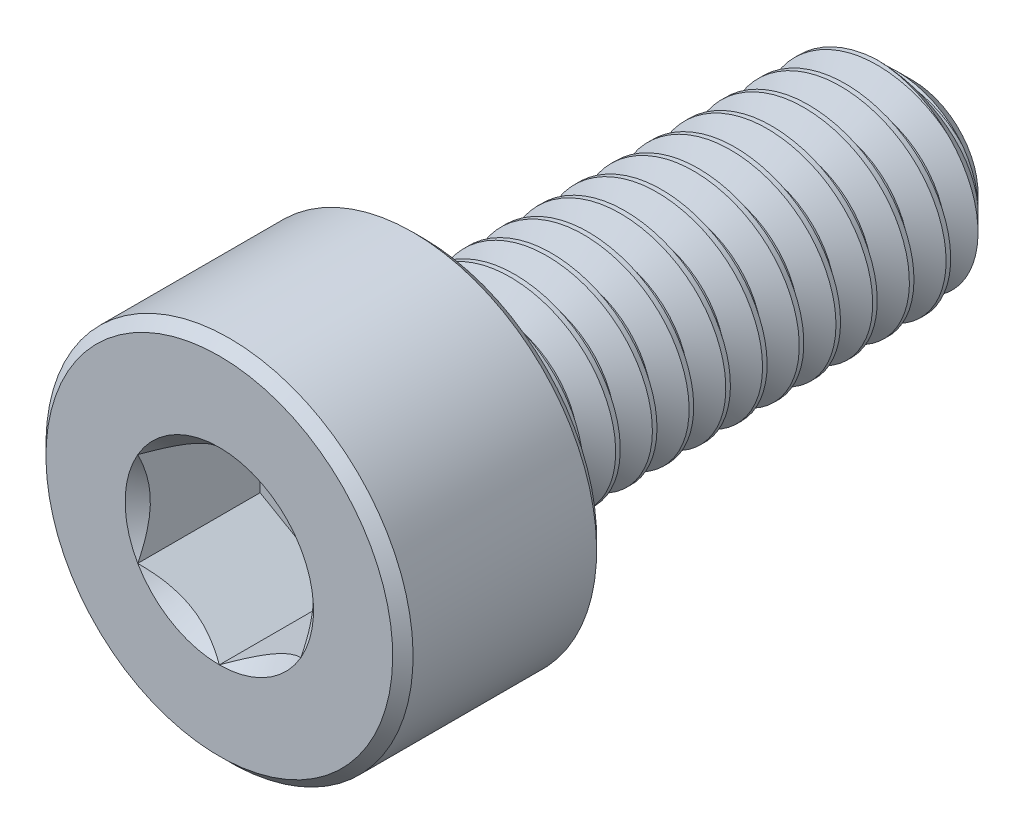
from build123d import *

# Parameters (mm, degrees)
CUT_EXTRUDE1_DEPTH = 1.5
CUT_SWEEP1_PITCH   = 0.45
CUT_SWEEP1_TO      = 6


with BuildPart() as part:
    # Sketch2 → Revolve1 (revolve)
    with BuildSketch(Plane(origin=(0, 0, 0), x_dir=(0, 0, -1), z_dir=(1, 0, 0))):
        Polygon((-4.25, 0), (-4.25, 2.125), (-4.125, 2.25), (-1.875, 2.25), (-1.75, 2.125), (-1.75, 1.25), (3.8, 1.25), (4.25, 0.8), (4.25, 0), align=None)
    revolve(axis=Axis((0, 0, -4.25), (0, 0, 1)))

    # Sketch3 → Cut-Extrude1 (cut)
    with BuildSketch(Plane.XY.offset(4.25)):
        Polygon((1, -0.577350269), (1, 0.577350269), (0, 1.154700538), (-1, 0.577350269), (-1, -0.577350269), (0, -1.154700538), align=None)
    extrude(amount=-CUT_EXTRUDE1_DEPTH, mode=Mode.SUBTRACT)

    # Cut-Extrude2 cone 1 section (through the dimple's axis) → Cut-Extrude2 (revolve, cut)
    with BuildSketch(Plane(origin=(0, 0, 4.25), x_dir=(0, -1, 0), z_dir=(1, 0, 0))):
        Polygon((0, 0), (1.154700538, 0), (0, 1.154700538), align=None)
    revolve(axis=Axis((0, 0, 4.25), (0, 0, -1)), mode=Mode.SUBTRACT)


with BuildPart() as body_2:
    # Split1: read off the stored shape, not the designer's step
    # Split1: the piece on the far side of the plane
    add(part.part)
    split(bisect_by=Plane.XY.offset(1.75), keep=Keep.BOTTOM)

    # Cut-Sweep1: arcs per turn and ends read off the stored shape
    # Cut-Sweep1: the profile of Sketch7 screwed along a right-hand helix through 14.483333 turns, 6 arcs to a turn; built about Z, then put on its axis
    cut_sweep1_z = Axis((0, 0, 0), (0, 0, 1))
    cut_sweep1_corners = [(1.274356964, 0, 0.0140625), (1.274356964, 0, -0.4078125), (0.957716426, 0, -0.225), (0.957716426, 0, -0.16875)]
    with BuildLine(mode=Mode.PRIVATE) as cut_sweep1_profile:
        Line(cut_sweep1_corners[0], cut_sweep1_corners[1])
        Line(cut_sweep1_corners[1], cut_sweep1_corners[2])
        Line(cut_sweep1_corners[2], cut_sweep1_corners[3])
        Line(cut_sweep1_corners[3], cut_sweep1_corners[0])
    cut_sweep1_cap = Face(cut_sweep1_profile.wire())
    cut_sweep1_turn_angles = [0, 30, 60, 90, 120, 150, 180, 210, 240, 270, 300, 330, 360]
    cut_sweep1_turn_weights = [1, 0.8660254037844387, 1, 0.8660254037844387, 1, 0.8660254037844387, 1, 0.8660254037844387, 1, 0.8660254037844387, 1, 0.8660254037844387, 1]
    cut_sweep1_turn_rails = [Edge.make_bspline([Vector(p[0], p[1], 0).rotate(cut_sweep1_z, cut_sweep1_turn_angles[k]) / cut_sweep1_turn_weights[k] + Vector(0, 0, p[2] + CUT_SWEEP1_PITCH * cut_sweep1_turn_angles[k] / 360) for k in range(13)], [0, 0, 0, 1, 1, 2, 2, 3, 3, 4, 4, 5, 5, 6, 6, 6], 2, cut_sweep1_turn_weights) for p in cut_sweep1_corners]
    cut_sweep1_turn_sides = [Face.make_surface_from_curves(cut_sweep1_turn_rails[p[0]], cut_sweep1_turn_rails[p[1]]) for p in [(0, 1), (1, 2), (2, 3), (3, 0)]]
    cut_sweep1_last_angles = [5040, 5070, 5100, 5130, 5160, 5187, 5214]
    cut_sweep1_last_weights = [1, 0.8660254037844387, 1, 0.8660254037844387, 1, 0.8910065241881229, 1]
    cut_sweep1_last_rails = [Edge.make_bspline([Vector(p[0], p[1], 0).rotate(cut_sweep1_z, cut_sweep1_last_angles[k]) / cut_sweep1_last_weights[k] + Vector(0, 0, p[2] + CUT_SWEEP1_PITCH * cut_sweep1_last_angles[k] / 360) for k in range(7)], [0, 0, 0, 1, 1, 2, 2, 3, 3, 3], 2, cut_sweep1_last_weights) for p in cut_sweep1_corners]
    cut_sweep1_last_sides = [Face.make_surface_from_curves(cut_sweep1_last_rails[p[0]], cut_sweep1_last_rails[p[1]]) for p in [(0, 1), (1, 2), (2, 3), (3, 0)]]
    cut_sweep1 = Plane(origin=(0, 0, -4.25), x_dir=(0, 1, 0), z_dir=(0, 0, 1)) * split(Solid(Shell([*[p.moved(Location((0, 0, CUT_SWEEP1_PITCH * i))) for i in range(14) for p in cut_sweep1_turn_sides], *cut_sweep1_last_sides, cut_sweep1_cap, cut_sweep1_cap.rotate(cut_sweep1_z, 5214).moved(Location((0, 0, CUT_SWEEP1_PITCH * 5214 / 360)))])), bisect_by=Plane.XY.offset(CUT_SWEEP1_TO), keep=Keep.BOTTOM, mode=Mode.PRIVATE)
    add(cut_sweep1, mode=Mode.SUBTRACT)


with BuildPart() as part_1:
    add(part.part)

    # Split1
    split(bisect_by=Plane.XY.offset(1.75), keep=Keep.TOP)

    add(body_2.part)  # Boss-Extrude1 merges body 2
    # Boss-Extrude1: read off the stored shape, not the designer's step
    # Boss-Extrude1 outline → Boss-Extrude1 (revolve)
    with BuildSketch(Plane.XZ):
        Polygon((0.957712238, 1.75), (0.957712238, 1.457712238), (1.25, 1.75), align=None)
    revolve(axis=Axis((0, 0, 0), (0, 0, 1)))


solid = part_1.part
